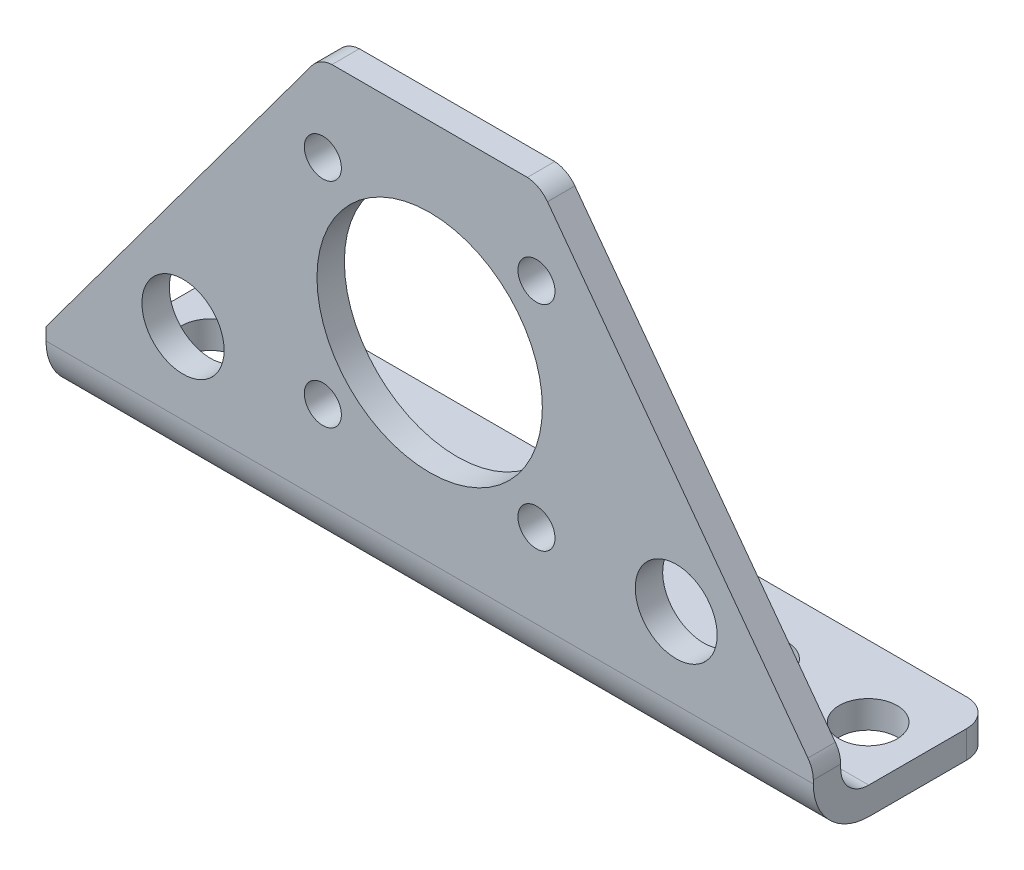
from build123d import *

# Parameters (mm, degrees)
BOSS_EXTRUDE1_DEPTH = 44.45
SKETCH2_OUTSIDE_W   = 111.802
SKETCH2_OUTSIDE_H   = 43.857
SKETCH2_OUTSIDE_R   = 3.3528
SKETCH2_OUTSIDE_R_2 = 6.35
CUT_EXTRUDE3_DEPTH  = 71.679236873
SKETCH3_OUTSIDE_W   = 111.802
SKETCH3_OUTSIDE_H   = 73.702
SKETCH3_OUTSIDE_R   = 2.1463
SKETCH3_OUTSIDE_R_2 = 13.0556
SKETCH3_OUTSIDE_R_3 = 4.7625
SKETCH3_OUTSIDE_R_4 = 4.743651166
CUT_EXTRUDE4_DEPTH  = 57.843495856


with BuildPart() as part:
    # Sketch1 → Boss-Extrude1 (new, symmetric)
    with BuildSketch(Plane.ZY):
        with BuildLine():
            Line((-20.955, -28.575), (-6.5, -28.575))
            ThreePointArc((-6.5, -28.575), (-1.903805922, -26.671194078), (0, -22.075))
            Line((0, -22.075), (0, 22.225))
            Line((0, 22.225), (-3.175, 22.225))
            Line((-3.175, 22.225), (-3.175, -22.15))
            ThreePointArc((-3.175, -22.15), (-4.126902961, -24.448097039), (-6.425, -25.4))
            Line((-6.425, -25.4), (-20.955, -25.4))
            Line((-20.955, -25.4), (-20.955, -28.575))
        make_face()
    extrude(amount=BOSS_EXTRUDE1_DEPTH, both=True)

    # Sketch2 outside → Cut-Extrude3 (cut, through all)
    # profile 1 of 6: a face of its own
    with BuildSketch(Plane.XZ.offset(28.575)):
        with Locations((0, -10.4775)):
            Rectangle(SKETCH2_OUTSIDE_W, SKETCH2_OUTSIDE_H)
        with BuildLine():
            Line((-41.280304188, -20.948744152), (41.275, -20.948744152))
            ThreePointArc((41.275, -20.948744152), (43.52006403, -20.018808183), (44.45, -17.773744152))
            Line((44.45, -17.773744152), (44.45, 4.535349672))
            Line((44.45, 4.535349672), (-44.455304188, 4.535349672))
            Line((-44.455304188, 4.535349672), (-44.455304188, -17.773744152))
            ThreePointArc((-44.455304188, -17.773744152), (-43.525368218, -20.018808183), (-41.280304188, -20.948744152))
        make_face(mode=Mode.SUBTRACT)
    # profile 2 of 6: a face of its own
    with BuildSketch(Plane.XZ.offset(28.575)):
        with Locations((-38.1, -12.7)):
            Circle(SKETCH2_OUTSIDE_R)
    # profile 3 of 6: a face of its own
    with BuildSketch(Plane.XZ.offset(28.575)):
        with Locations((-25.4, -12.7)):
            Circle(SKETCH2_OUTSIDE_R)
    # profile 4 of 6: a face of its own
    with BuildSketch(Plane.XZ.offset(28.575)):
        with Locations((0, -12.7)):
            Circle(SKETCH2_OUTSIDE_R_2)
    # profile 5 of 6: a face of its own
    with BuildSketch(Plane.XZ.offset(28.575)):
        with Locations((25.4, -12.7)):
            Circle(SKETCH2_OUTSIDE_R)
    # profile 6 of 6: a face of its own
    with BuildSketch(Plane.XZ.offset(28.575)):
        with Locations((38.1, -12.7)):
            Circle(SKETCH2_OUTSIDE_R)
    extrude(amount=-CUT_EXTRUDE3_DEPTH, mode=Mode.SUBTRACT)

    # Sketch3 outside → Cut-Extrude4 (cut, through all)
    # profile 1 of 8: a face of its own
    with BuildSketch(Plane.XY):
        with Locations((0, -3.175)):
            Rectangle(SKETCH3_OUTSIDE_W, SKETCH3_OUTSIDE_H)
        with BuildLine():
            Line((-13.653876698, 20.947210396), (-44.450826739, -20.631729198))
            Line((-44.450826739, -20.631729198), (-44.450826739, -28.575))
            Line((-44.450826739, -28.575), (44.45, -28.575))
            Line((44.45, -28.575), (44.45, -21.674369393))
            ThreePointArc((44.45, -21.674369393), (44.29004015, -20.679302615), (43.826278492, -19.784500865))
            Line((43.826278492, -19.784500865), (13.654037866, 20.947321174))
            ThreePointArc((13.654037866, 20.947321174), (12.531096243, 21.893026448), (11.102759374, 22.232452646))
            Line((11.102759374, 22.232452646), (-11.10251615, 22.232452646))
            ThreePointArc((-11.10251615, 22.232452646), (-12.530914579, 21.892995438), (-13.653876698, 20.947210396))
        make_face(mode=Mode.SUBTRACT)
    # profile 2 of 8: a face of its own
    with BuildSketch(Plane.XY):
        with Locations((-12.374792935, 12.374792935)):
            Circle(SKETCH3_OUTSIDE_R)
    # profile 3 of 8: a face of its own
    with BuildSketch(Plane.XY):
        with Locations((12.374792935, 12.374792935)):
            Circle(SKETCH3_OUTSIDE_R)
    # profile 4 of 8: a face of its own
    with BuildSketch(Plane.XY):
        Circle(SKETCH3_OUTSIDE_R_2)
    # profile 5 of 8: a face of its own
    with BuildSketch(Plane.XY):
        with Locations((-28.575, -12.7)):
            Circle(SKETCH3_OUTSIDE_R_3)
    # profile 6 of 8: a face of its own
    with BuildSketch(Plane.XY):
        with Locations((-12.374792935, -12.374792935)):
            Circle(SKETCH3_OUTSIDE_R)
    # profile 7 of 8: a face of its own
    with BuildSketch(Plane.XY):
        with Locations((12.374792935, -12.374792935)):
            Circle(SKETCH3_OUTSIDE_R)
    # profile 8 of 8: a face of its own
    with BuildSketch(Plane.XY):
        with Locations((28.564780042, -12.715837646)):
            Circle(SKETCH3_OUTSIDE_R_4)
    extrude(amount=-CUT_EXTRUDE4_DEPTH, mode=Mode.SUBTRACT)


solid = part.part
